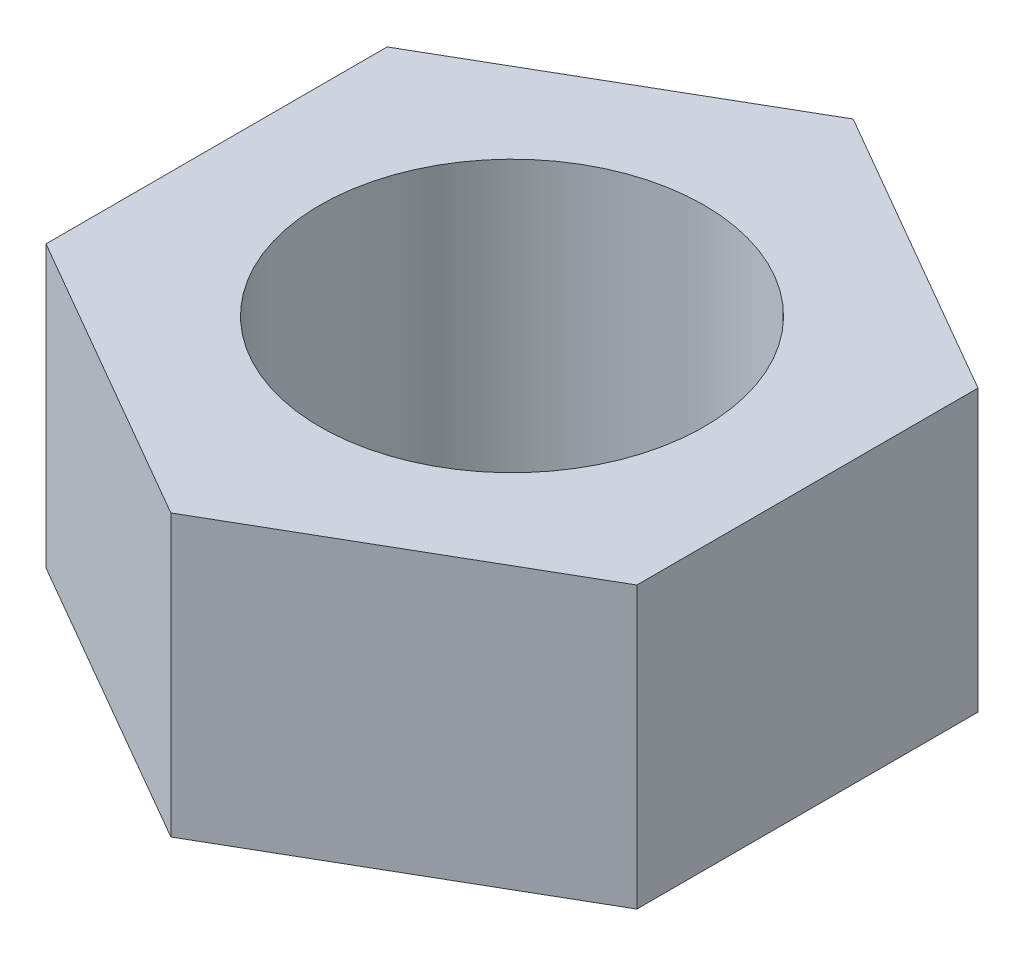
from build123d import *

# Parameters (mm, degrees)
SKETCH_1_R      = 2.6
EXTRUDE_1_DEPTH = 3.8


with BuildPart() as part:
    # Эскиз1 → Бобышка-Вытянуть1 (new body)
    with BuildSketch(Plane(origin=(0, 0, 0), x_dir=(1, 0, 0), z_dir=(0, 1, 0))):
        Polygon((4, -2.309401077), (4, 2.309401077), (0, 4.618802154), (-4, 2.309401077), (-4, -2.309401077), (0, -4.618802154), align=None)
        Circle(SKETCH_1_R, mode=Mode.SUBTRACT)
    extrude(amount=EXTRUDE_1_DEPTH)


solid = part.part
